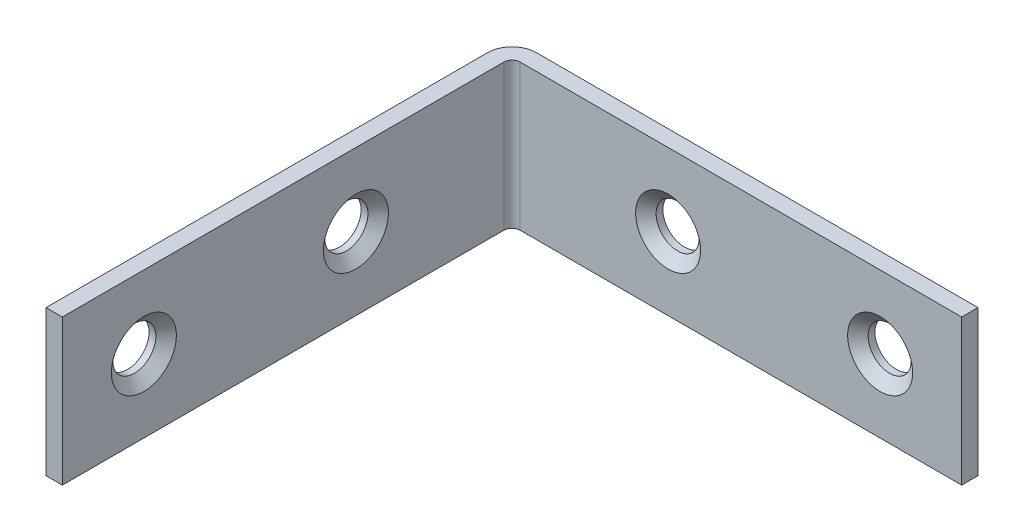
from build123d import *

# Parameters (mm, degrees)
EXTRUDE_THIN1_START          = -7.9375
EXTRUDE_THIN1_DEPTH          = 15.875
SKETCH4_R                    = 2.3495
EXTRUDE3_DEPTH               = 69.543095394
SKETCH7_R                    = 3.5433
CUT_EXTRUDE1_DEPTH           = 72.040836075
CUT_EXTRUDE1_DRAFT           = -49
CUT_EXTRUDE1_PROFILE_2_DEPTH = 72.040836075
CUT_EXTRUDE1_PROFILE_2_DRAFT = -49
CIRPATTERN1_COUNT            = 2
CIRPATTERN1_COPY_1_SKETCH_R  = 3.5433
CIRPATTERN1_COPY_1_DEPTH     = 72.040836075
CIRPATTERN1_COPY_1_DRAFT     = -49
CIRPATTERN1_COPY_2_SKETCH_R  = 3.5433
CIRPATTERN1_COPY_2_DEPTH     = 72.040836075
CIRPATTERN1_COPY_2_DRAFT     = -49
CIRPATTERN1_COPY_3_SKETCH_R  = 3.5433
CIRPATTERN1_COPY_3_DEPTH     = 72.040836075
CIRPATTERN1_COPY_3_DRAFT     = -49


# Read off the part's stored shape, not the designer's step: Extrude-Thin1
with BuildPart() as part:
    # Extrude-Thin1 outline → Extrude-Thin1 (new body)
    with BuildSketch(Plane(origin=(0, 0, 0), x_dir=(1, 0, 0), z_dir=(0, 1, 0)).offset(EXTRUDE_THIN1_START)):
        with BuildLine():
            Line((2.667, -1.778), (50.8, -1.778))
            Line((50.8, -1.778), (50.8, 0))
            Line((50.8, 0), (2.667, 0))
            ThreePointArc((2.667, 0), (0.781146215, -0.781146215), (0, -2.667))
            Line((0, -2.667), (0, -50.8))
            Line((0, -50.8), (1.778, -50.8))
            Line((1.778, -50.8), (1.778, -2.667))
            ThreePointArc((1.778, -2.667), (2.038382072, -2.038382072), (2.667, -1.778))
        make_face()
    extrude(amount=EXTRUDE_THIN1_DEPTH)

    # Sketch4 → Extrude3 (cut, through all)
    with BuildSketch(Plane(origin=(3.556, 0, 1.778), x_dir=(1, 0, 0), z_dir=(0, 0, 1))):
        with Locations((38.354, 0)):
            Circle(SKETCH4_R)
        with Locations((15.24, 0)):
            Circle(SKETCH4_R)
    extrude3 = extrude(amount=-EXTRUDE3_DEPTH, mode=Mode.SUBTRACT)


with BuildPart() as cut_extrude1_tool:
    # Sketch7 → Cut-Extrude1 (with draft: the straight prism first)
    with BuildSketch(Plane.XY.offset(1.778)):
        with Locations((41.91, 0)):
            Circle(SKETCH7_R)
    extrude(amount=-CUT_EXTRUDE1_DEPTH)
    # Cut-Extrude1: the draft: its side faces are tilted about the plane it starts from
    cut_extrude1_sides = [cut_extrude1_tool.faces().sort_by_distance(p)[0] for p in [
        (38.3667, 0, -34.242418038),
    ]]
    draft(cut_extrude1_sides, Plane.XY.offset(1.778), CUT_EXTRUDE1_DRAFT)


with BuildPart() as part_1:
    add(part.part)

    # Cut-Extrude1: cut by cut_extrude1_tool
    add(cut_extrude1_tool.part, mode=Mode.SUBTRACT)


with BuildPart() as cut_extrude1_profile_2_tool:
    # Sketch7 → Cut-Extrude1 profile 2 (with draft: the straight prism first)
    with BuildSketch(Plane.XY.offset(1.778)):
        with Locations((18.796, 0)):
            Circle(SKETCH7_R)
    extrude(amount=-CUT_EXTRUDE1_PROFILE_2_DEPTH)
    # Cut-Extrude1 profile 2: the draft: its side faces are tilted about the plane it starts from
    cut_extrude1_profile_2_sides = [cut_extrude1_profile_2_tool.faces().sort_by_distance(p)[0] for p in [
        (15.2527, 0, -34.242418038),
    ]]
    draft(cut_extrude1_profile_2_sides, Plane.XY.offset(1.778), CUT_EXTRUDE1_PROFILE_2_DRAFT)


with BuildPart() as part_2:
    add(part_1.part)

    # Cut-Extrude1 profile 2: cut by cut_extrude1_profile_2_tool
    add(cut_extrude1_profile_2_tool.part, mode=Mode.SUBTRACT)

    # CirPattern1: Extrude3 ×2 about axis
    cirpattern1_axis = Axis((0, 0, 0), (0.7071067811865464, 0, 0.7071067811865487))
    for i in range(1, CIRPATTERN1_COUNT):
        add(extrude3.rotate(cirpattern1_axis, i * 360 / CIRPATTERN1_COUNT), mode=Mode.SUBTRACT)


with BuildPart() as cirpattern1_copy_1_tool:
    # CirPattern1 copy 1 sketch → CirPattern1 copy 1 (with draft: the straight prism first)
    with BuildSketch(Plane(origin=(1.778, 0, 0), x_dir=(0, 0, 1), z_dir=(1, 0, 0))):
        with Locations((41.91, 0)):
            Circle(CIRPATTERN1_COPY_1_SKETCH_R)
    extrude(amount=-CIRPATTERN1_COPY_1_DEPTH)
    # CirPattern1 copy 1: the draft: its side faces are tilted about the plane it starts from
    cirpattern1_copy_1_sides = [cirpattern1_copy_1_tool.faces().sort_by_distance(p)[0] for p in [
        (-34.242418038, 0, 38.3667),
    ]]
    draft(cirpattern1_copy_1_sides, Plane(origin=(1.778, 0, 0), x_dir=(0, 0, 1), z_dir=(1, 0, 0)), CIRPATTERN1_COPY_1_DRAFT)


with BuildPart() as part_3:
    add(part_2.part)

    # CirPattern1 copy 1: cut by cirpattern1_copy_1_tool
    add(cirpattern1_copy_1_tool.part, mode=Mode.SUBTRACT)


with BuildPart() as cirpattern1_copy_2_tool:
    # CirPattern1 copy 2 sketch → CirPattern1 copy 2 (with draft: the straight prism first)
    with BuildSketch(Plane(origin=(1.778, 0, 0), x_dir=(0, 0, 1), z_dir=(1, 0, 0))):
        with Locations((18.796, 0)):
            Circle(CIRPATTERN1_COPY_2_SKETCH_R)
    extrude(amount=-CIRPATTERN1_COPY_2_DEPTH)
    # CirPattern1 copy 2: the draft: its side faces are tilted about the plane it starts from
    cirpattern1_copy_2_sides = [cirpattern1_copy_2_tool.faces().sort_by_distance(p)[0] for p in [
        (-34.242418038, 0, 15.2527),
    ]]
    draft(cirpattern1_copy_2_sides, Plane(origin=(1.778, 0, 0), x_dir=(0, 0, 1), z_dir=(1, 0, 0)), CIRPATTERN1_COPY_2_DRAFT)


with BuildPart() as part_4:
    add(part_3.part)

    # CirPattern1 copy 2: cut by cirpattern1_copy_2_tool
    add(cirpattern1_copy_2_tool.part, mode=Mode.SUBTRACT)


with BuildPart() as cirpattern1_copy_3_tool:
    # CirPattern1 copy 3 sketch → CirPattern1 copy 3 (with draft: the straight prism first)
    with BuildSketch(Plane(origin=(1.778, 0, 0), x_dir=(0, 0, 1), z_dir=(1, 0, 0))):
        with Locations((18.796, 0)):
            Circle(CIRPATTERN1_COPY_3_SKETCH_R)
    extrude(amount=-CIRPATTERN1_COPY_3_DEPTH)
    # CirPattern1 copy 3: the draft: its side faces are tilted about the plane it starts from
    cirpattern1_copy_3_sides = [cirpattern1_copy_3_tool.faces().sort_by_distance(p)[0] for p in [
        (-34.242418038, 0, 15.2527),
    ]]
    draft(cirpattern1_copy_3_sides, Plane(origin=(1.778, 0, 0), x_dir=(0, 0, 1), z_dir=(1, 0, 0)), CIRPATTERN1_COPY_3_DRAFT)


with BuildPart() as part_5:
    add(part_4.part)

    # CirPattern1 copy 3: cut by cirpattern1_copy_3_tool
    add(cirpattern1_copy_3_tool.part, mode=Mode.SUBTRACT)


solid = part_5.part
